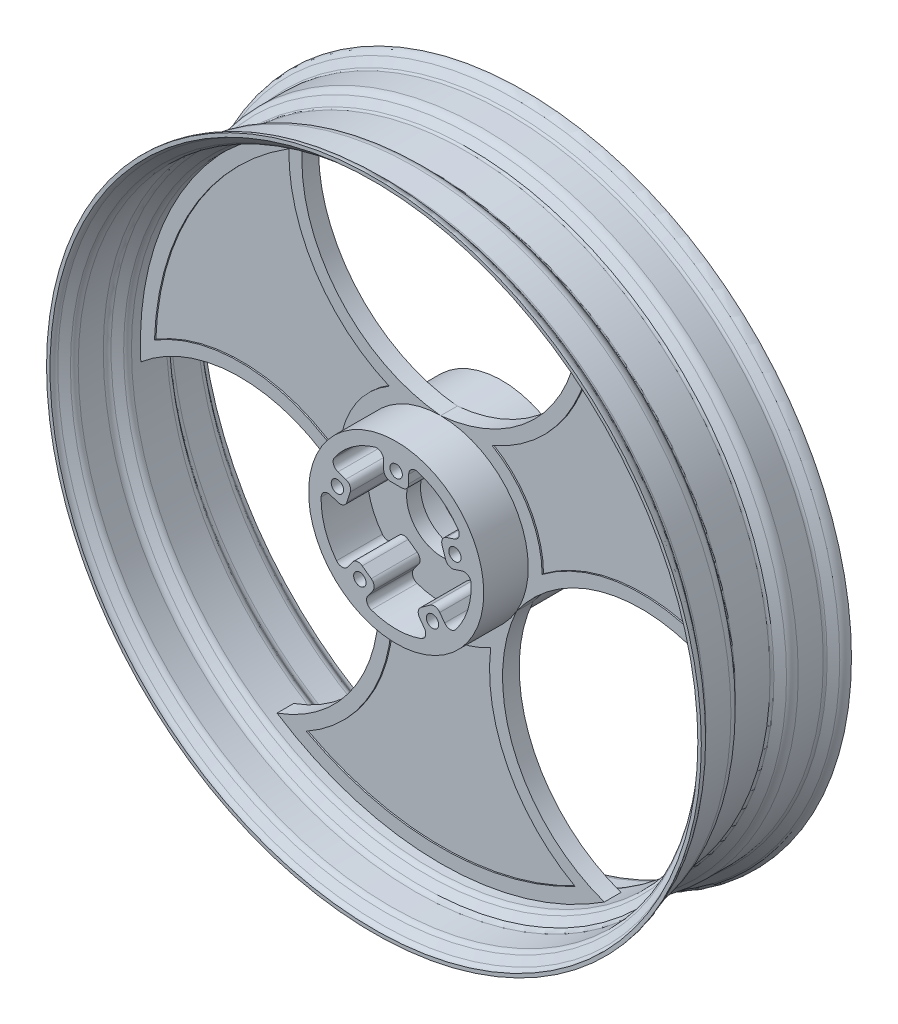
from build123d import *

# Parameters (mm, degrees)
CUT_EXTRUDE1_REACH  = 340.409
CIRPATTERN1_COUNT   = 3
CUT_EXTRUDE2_DEPTH  = 1
SKETCH4_R           = 54
CUT_EXTRUDE3_DEPTH  = 33
SKETCH5_R           = 25.5
CUT_EXTRUDE4_DEPTH  = 339.23290792
BOSS_EXTRUDE1_DEPTH = 33
SKETCH7_R           = 4.45
CUT_EXTRUDE5_DEPTH  = 25
CIRPATTERN2_COUNT   = 5
FILLET1_R           = 5


with BuildPart() as part:
    # Sketch1 → Revolve1 (revolve)
    with BuildSketch(Plane(origin=(0, 0, 0), x_dir=(0, 0, -1), z_dir=(1, 0, 0)), mode=Mode.PRIVATE) as revolve1_sk:
        with BuildLine():
            Line((-38, 0), (38, 0))
            Line((38, 0), (38, 63))
            Line((38, 63), (6, 63))
            Line((6, 63), (6, 216))
            Line((6, 216), (12.409153107, 216))
            ThreePointArc((12.409153107, 216), (14.522244416, 216.468461065), (16.239375322, 217.786061952))
            Line((16.239375322, 217.786061952), (20.374354338, 222.713938048))
            ThreePointArc((20.374354338, 222.713938048), (22.091485245, 224.031538935), (24.204576553, 224.5))
            Line((24.204576553, 224.5), (42.204576553, 224.5))
            ThreePointArc((42.204576553, 224.5), (44.317667862, 224.968461065), (46.034798769, 226.286061952))
            Line((46.034798769, 226.286061952), (50.169777784, 231.213938048))
            ThreePointArc((50.169777784, 231.213938048), (51.886908691, 232.531538935), (54, 233))
            Line((54, 233), (54, 235.5))
            ThreePointArc((54, 235.5), (50.830363037, 234.797308403), (48.254666677, 232.820907073))
            Line((48.254666677, 232.820907073), (44.119687661, 227.893030976))
            ThreePointArc((44.119687661, 227.893030976), (43.261122208, 227.234230532), (42.204576553, 227))
            Line((42.204576553, 227), (24.204576553, 227))
            ThreePointArc((24.204576553, 227), (21.03493959, 226.297308403), (18.45924323, 224.320907073))
            Line((18.45924323, 224.320907073), (14.324264215, 219.393030976))
            ThreePointArc((14.324264215, 219.393030976), (13.465698761, 218.734230532), (12.409153107, 218.5))
            Line((12.409153107, 218.5), (0, 218.5))
            Line((0, 218.5), (-12.409153107, 218.5))
            ThreePointArc((-12.409153107, 218.5), (-13.465698761, 218.734230532), (-14.324264215, 219.393030976))
            Line((-14.324264215, 219.393030976), (-18.45924323, 224.320907073))
            ThreePointArc((-18.45924323, 224.320907073), (-21.03493959, 226.297308403), (-24.204576553, 227))
            Line((-24.204576553, 227), (-42.204576553, 227))
            ThreePointArc((-42.204576553, 227), (-43.261122208, 227.234230532), (-44.119687661, 227.893030976))
            Line((-44.119687661, 227.893030976), (-48.254666677, 232.820907073))
            ThreePointArc((-48.254666677, 232.820907073), (-50.830363037, 234.797308403), (-54, 235.5))
            Line((-54, 235.5), (-54, 233))
            ThreePointArc((-54, 233), (-51.886908691, 232.531538935), (-50.169777784, 231.213938048))
            Line((-50.169777784, 231.213938048), (-46.034798769, 226.286061952))
            ThreePointArc((-46.034798769, 226.286061952), (-44.317667862, 224.968461065), (-42.204576553, 224.5))
            Line((-42.204576553, 224.5), (-24.204576553, 224.5))
            ThreePointArc((-24.204576553, 224.5), (-22.091485245, 224.031538935), (-20.374354338, 222.713938048))
            Line((-20.374354338, 222.713938048), (-16.239375322, 217.786061952))
            ThreePointArc((-16.239375322, 217.786061952), (-14.522244416, 216.468461065), (-12.409153107, 216))
            Line((-12.409153107, 216), (-6, 216))
            Line((-6, 216), (-6, 63))
            Line((-6, 63), (-38, 63))
            Line((-38, 63), (-38, 0))
        make_face()
    revolve(revolve1_sk.sketch.rotate(Axis((0, 0, 108.105691878), (0, 0, -1)), 90), axis=Axis((0, 0, 108.105691878), (0, 0, -1)))

    # Sketch2 → Cut-Extrude1 (cut, up to next)
    with BuildSketch(Plane.XY.offset(6), mode=Mode.PRIVATE) as cut_extrude1_sk1:
        with BuildLine():
            ThreePointArc((0, 63), (77.538137266, 106.146211007), (98, 192.488960722))
            ThreePointArc((98, 192.488960722), (0, 216), (-98, 192.488960722))
            ThreePointArc((-98, 192.488960722), (-77.538137266, 106.146211007), (0, 63))
        make_face()
    cut_extrude1_tool1 = extrude(cut_extrude1_sk1.sketch, amount=-CUT_EXTRUDE1_REACH, mode=Mode.PRIVATE) & part.part
    cut_extrude1 = cut_extrude1_tool1.solids().sort_by_distance((0, 145.943107, 6))[0]
    add(cut_extrude1, mode=Mode.SUBTRACT)

    # CirPattern1: Cut-Extrude1 ×3 about axis
    cirpattern1_axis = Axis((0, 0, 0), (0, 0, 1))
    for i in range(1, CIRPATTERN1_COUNT):
        add(cut_extrude1.rotate(cirpattern1_axis, i * 360 / CIRPATTERN1_COUNT), mode=Mode.SUBTRACT)

    # Sketch3 → Cut-Extrude2 (cut)
    with BuildSketch(Plane.XY.offset(6)):
        with BuildLine():
            ThreePointArc((-96.711141934, -181.887204129), (-48.315376308, -131.957501846), (-35.959059696, -63.529095899))
            ThreePointArc((-35.959059696, -63.529095899), (0, -73), (35.959059696, -63.529095899))
            ThreePointArc((35.959059696, -63.529095899), (48.315376308, -131.957501846), (96.711141934, -181.887204129))
            ThreePointArc((96.711141934, -181.887204129), (0, -206), (-96.711141934, -181.887204129))
        make_face()
        with BuildLine():
            ThreePointArc((205.874510366, 7.189296321), (138.436236972, 24.136407646), (72.997340776, 0.623088756))
            ThreePointArc((72.997340776, 0.623088756), (63.219854476, 36.5), (37.03828108, 62.906007143))
            ThreePointArc((37.03828108, 62.906007143), (90.120860664, 107.821094199), (109.163368432, 174.697907808))
            ThreePointArc((109.163368432, 174.697907808), (178.40123318, 103), (205.874510366, 7.189296321))
        make_face()
        with BuildLine():
            ThreePointArc((-37.03828108, 62.906007143), (-63.219854476, 36.5), (-72.997340776, 0.623088756))
            ThreePointArc((-72.997340776, 0.623088756), (-138.436236972, 24.136407646), (-205.874510366, 7.189296321))
            ThreePointArc((-205.874510366, 7.189296321), (-178.40123318, 103), (-109.163368432, 174.697907808))
            ThreePointArc((-109.163368432, 174.697907808), (-90.120860664, 107.821094199), (-37.03828108, 62.906007143))
        make_face()
    cut_extrude2 = extrude(amount=-CUT_EXTRUDE2_DEPTH, mode=Mode.SUBTRACT)

    # Mirror1: Cut-Extrude2 across plane
    add(cut_extrude2.mirror(Plane.XY), mode=Mode.SUBTRACT)

    # Sketch4 → Cut-Extrude3 (cut)
    with BuildSketch(Plane.XY.offset(38)):
        Circle(SKETCH4_R)
    cut_extrude3 = extrude(amount=-CUT_EXTRUDE3_DEPTH, mode=Mode.SUBTRACT)

    # Mirror3: Cut-Extrude3 across plane
    add(cut_extrude3.mirror(Plane.XY), mode=Mode.SUBTRACT)

    # Sketch5 → Cut-Extrude4 (cut, through all)
    with BuildSketch(Plane.XY.offset(5)):
        Circle(SKETCH5_R)
    extrude(amount=-CUT_EXTRUDE4_DEPTH, mode=Mode.SUBTRACT)

    # Sketch6 → Boss-Extrude1 (add)
    with BuildSketch(Plane.XY.offset(5)):
        with BuildLine():
            Line((-9, 36), (9, 36))
            Line((9, 36), (9, 53.244718048))
            ThreePointArc((9, 53.244718048), (0, 54), (-9, 53.244718048))
            Line((-9, 53.244718048), (-9, 36))
        make_face()
    boss_extrude1 = extrude(amount=BOSS_EXTRUDE1_DEPTH)

    # Sketch7 → Cut-Extrude5 (cut)
    with BuildSketch(Plane.XY.offset(38)):
        with Locations((0, 44.45)):
            Circle(SKETCH7_R)
    cut_extrude5 = extrude(amount=-CUT_EXTRUDE5_DEPTH, mode=Mode.SUBTRACT)

    # CirPattern2: Boss-Extrude1, Cut-Extrude5 ×5 about axis
    cirpattern2_axis = Axis((0, 0, 0), (0, 0, 1))
    add([boss_extrude1.rotate(cirpattern2_axis, i * 360 / CIRPATTERN2_COUNT) for i in range(1, CIRPATTERN2_COUNT)])
    add([cut_extrude5.rotate(cirpattern2_axis, i * 360 / CIRPATTERN2_COUNT) for i in range(1, CIRPATTERN2_COUNT)], mode=Mode.SUBTRACT)

    # Fillet1
    # the kernel refuses this fillet: 5 mm, written as the material it adds along each edge
    with BuildSketch(Plane(origin=(-9, 53.244718048, 5), x_dir=(0, -1, 0), z_dir=(0, 0, 1))) as fillet1_piece_1:
        with BuildLine():
            CenterArc((6.28729052, -5), FILLET1_R, 90, 106.601549599)
            Line((1.495716283, -6.428571429), (1.399884798, -6.457142857))
            ThreePointArc((1.399884798, -6.457142857), (0.552149343, -3.259820689), (-0.09860133, -0.016666667))
            Line((-0.09860133, -0.016666667), (0, 0.1))
            Line((0, 0.1), (6.28729052, 0.1))
            Line((6.28729052, 0.1), (6.28729052, 0))
        make_face()
    extrude(amount=33)
    with BuildSketch(Plane(origin=(9, 53.244718048, 5), x_dir=(0, -1, 0), z_dir=(0, 0, 1)), Plane(origin=(-47.857583108, 25.013031384, 5), x_dir=(0.9510565162951538, -0.30901699437494706, 0), z_dir=(0, 0, 1)), Plane(origin=(-38.57761298, -37.785814491, 5), x_dir=(0.5877852522924735, 0.8090169943749471, 0), z_dir=(0, 0, 1)), Plane(origin=(24.015307082, -48.365949032, 5), x_dir=(-0.5877852522924729, 0.8090169943749476, 0), z_dir=(0, 0, 1)), Plane(origin=(53.419889007, 7.894014091, 5), x_dir=(-0.9510565162951538, -0.309016994374947, 0), z_dir=(0, 0, 1))) as fillet1_piece_2:
        with BuildLine():
            CenterArc((6.28729052, 5), FILLET1_R, 163.398450401, 106.601549599)
            Line((1.495716283, 6.428571429), (1.399884798, 6.457142857))
            ThreePointArc((1.399884798, 6.457142857), (0.552149343, 3.259820689), (-0.09860133, 0.016666667))
            Line((-0.09860133, 0.016666667), (0, -0.1))
            Line((0, -0.1), (6.28729052, -0.1))
            Line((6.28729052, -0.1), (6.28729052, 0))
        make_face()
    extrude(amount=33)
    with BuildSketch(Plane(origin=(-53.419889007, 7.894014091, 5), x_dir=(-0.08545502499626349, -0.9963420289754357, 0), z_dir=(0, 0, 1)), Plane(origin=(-24.015307082, -48.365949032, 5), x_dir=(0.9211705241372417, -0.38915917753628704, 0), z_dir=(0, 0, 1)), Plane(origin=(38.57761298, -37.785814491, 5), x_dir=(0.6547697183476342, 0.7558284302240554, 0), z_dir=(0, 0, 1)), Plane(origin=(47.857583108, 25.013031384, 5), x_dir=(-0.5165005833942078, 0.8562868370782323, 0), z_dir=(0, 0, 1))) as fillet1_piece_3:
        with BuildLine():
            CenterArc((6.294711607, 4.990654053), FILLET1_R, 166.902191087, 106.601549599)
            Line((1.424788436, 6.123724357), (1.327389973, 6.146385763))
            Line((1.327389973, 6.146385763), (-0.097398463, 0.022661406))
            Line((-0.097398463, 0.022661406), (-0.00611137, -0.099813081))
            ThreePointArc((-0.00611137, -0.099813081), (3.300140066, -0.200936228), (6.606391502, -0.099813081))
            Line((6.606391502, -0.099813081), (6.600280131, 0))
        make_face()
    extrude(amount=33)
    # the kernel refuses this fillet: 5 mm, written as the material it takes off along each edge
    with BuildSketch(Plane(origin=(9, 36, 5), x_dir=(-1, 0, 0), z_dir=(0, 0, 1)), Plane(origin=(-9, 36, 5), x_dir=(0, 1, 0), z_dir=(0, 0, 1)), Plane(origin=(-31.456881637, 19.684120444, 5), x_dir=(-0.309016994374948, -0.9510565162951533, 0), z_dir=(0, 0, 1)), Plane(origin=(-37.019187536, 2.565103151, 5), x_dir=(-0.9510565162951536, 0.3090169943749472, 0), z_dir=(0, 0, 1)), Plane(origin=(-28.441422032, -23.834544527, 5), x_dir=(0.8090169943749472, -0.5877852522924734, 0), z_dir=(0, 0, 1)), Plane(origin=(-13.879116133, -34.414679068, 5), x_dir=(-0.5877852522924728, -0.8090169943749476, 0), z_dir=(0, 0, 1)), Plane(origin=(13.879116133, -34.414679068, 5), x_dir=(0.8090169943749472, 0.5877852522924734, 0), z_dir=(0, 0, 1)), Plane(origin=(28.441422032, -23.834544527, 5), x_dir=(0.5877852522924722, -0.809016994374948, 0), z_dir=(0, 0, 1)), Plane(origin=(37.019187536, 2.565103151, 5), x_dir=(-0.3090169943749473, 0.9510565162951536, 0), z_dir=(0, 0, 1)), Plane(origin=(31.456881637, 19.684120444, 5), x_dir=(0.9510565162951538, 0.30901699437494684, 0), z_dir=(0, 0, 1))) as fillet1_2_piece_1:
        with BuildLine():
            CenterArc((FILLET1_R, -FILLET1_R), FILLET1_R, 90, 90)
            Line((0, -FILLET1_R), (-FILLET1_R * 0.02, -FILLET1_R))
            Line((-FILLET1_R * 0.02, -FILLET1_R), (-FILLET1_R * 0.02, FILLET1_R * 0.02))
            Line((-FILLET1_R * 0.02, FILLET1_R * 0.02), (FILLET1_R, FILLET1_R * 0.02))
            Line((FILLET1_R, FILLET1_R * 0.02), (FILLET1_R, 0))
        make_face()
    extrude(amount=33, mode=Mode.SUBTRACT)


solid = part.part
